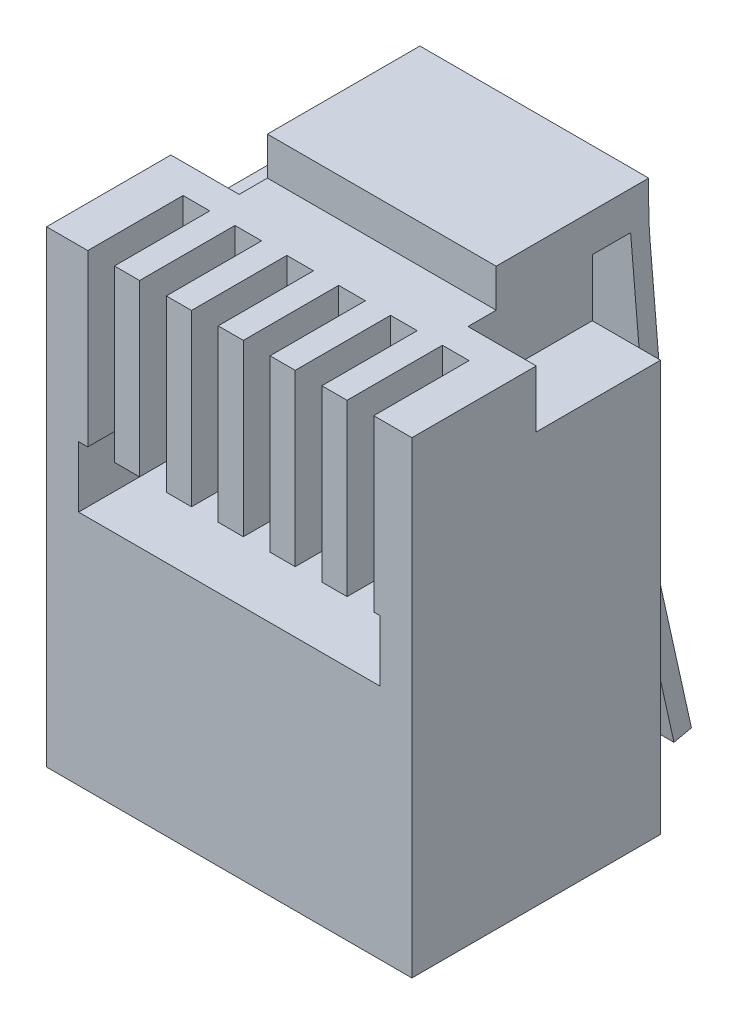
from build123d import *

# Parameters (mm, degrees)
SKETCH_1_W          = 9.58
SKETCH_1_H          = 12.27
EXTRUDE_1_DEPTH     = 6.52
SKETCH_2_W          = 7.9
SKETCH_2_H          = 1.6
CUT_EXTRUDE_1_DEPTH = 4
SKETCH_3_W          = 0.7
SKETCH_3_H          = 5.068026785
CUT_EXTRUDE_2_DEPTH = 2.5
SKETCH_4_W          = 6
SKETCH_4_H          = 4
EXTRUDE_2_DEPTH     = 1
SKETCH_5_W          = 1.79
SKETCH_5_H          = 3.771756959
CUT_EXTRUDE_3_DEPTH = 1.5
EXTRUDE_3_DEPTH     = 3
EXTRUDE_4_DEPTH     = 1.6
FILLET_1_R          = 10
SKETCH_8_W          = 7.58
SKETCH_8_H          = 4.52
CUT_EXTRUDE_4_DEPTH = 6


with BuildPart() as part:
    # 草图1 → 凸台-拉伸1 (new body)
    with BuildSketch(Plane.XY):
        with Locations((4.79, 6.135)):
            Rectangle(SKETCH_1_W, SKETCH_1_H)
    extrude(amount=EXTRUDE_1_DEPTH)

    # 草图2 → 切除-拉伸1 (cut)
    with BuildSketch(Plane.XY.offset(6.52)):
        with Locations((4.79, 7.01)):
            Rectangle(SKETCH_2_W, SKETCH_2_H)
    extrude(amount=-CUT_EXTRUDE_1_DEPTH, mode=Mode.SUBTRACT)

    # 草图3 → 切除-拉伸2 (cut)
    with BuildSketch(Plane.XY.offset(6.52)):
        with Locations((8.23, 10.008542357)):
            Rectangle(SKETCH_3_W, SKETCH_3_H)
        with Locations((6.87, 10.008542357)):
            Rectangle(SKETCH_3_W, SKETCH_3_H)
        with Locations((5.51, 10.008542357)):
            Rectangle(SKETCH_3_W, SKETCH_3_H)
        with Locations((4.15, 10.008542357)):
            Rectangle(SKETCH_3_W, SKETCH_3_H)
        with Locations((2.79, 10.008542357)):
            Rectangle(SKETCH_3_W, SKETCH_3_H)
        with Locations((1.43, 10.008542357)):
            Rectangle(SKETCH_3_W, SKETCH_3_H)
    extrude(amount=-CUT_EXTRUDE_2_DEPTH, mode=Mode.SUBTRACT)

    # 草图4 → 凸台-拉伸2 (add)
    with BuildSketch(Plane(origin=(0, 12.27, 0), x_dir=(1, 0, 0), z_dir=(0, 1, 0))):
        with Locations((4.79, -0.52)):
            Rectangle(SKETCH_4_W, SKETCH_4_H)
    extrude(amount=EXTRUDE_2_DEPTH)

    # 草图5 → 切除-拉伸3 (cut)
    with BuildSketch(Plane(origin=(0, 12.27, 0), x_dir=(1, 0, 0), z_dir=(0, 1, 0))):
        with Locations((8.685, -1.374121521)):
            Rectangle(SKETCH_5_W, SKETCH_5_H)
        with Locations((0.895, -1.374121521)):
            Rectangle(SKETCH_5_W, SKETCH_5_H)
    extrude(amount=-CUT_EXTRUDE_3_DEPTH, mode=Mode.SUBTRACT)

    # 草图6 → 凸台-拉伸3 (add, symmetric)
    with BuildSketch(Plane.ZY.offset(-4.79)):
        Polygon((-1.48, 12.27), (-1.75, 8.942581669), (-1.278125841, 8.904291917), (-1.005018858, 12.27), align=None)
    extrude(amount=EXTRUDE_3_DEPTH, both=True)

    # 草图7 → 凸台-拉伸4 (add, symmetric)
    with BuildSketch(Plane.ZY.offset(-4.79)):
        Polygon((-1.75, 8.942581669), (-4, -1.173649155), (-3.542253598, -1.275458754), (-1.278125841, 8.904291917), align=None)
    extrude(amount=EXTRUDE_4_DEPTH, both=True)

    # 圆角1
    # the kernel refuses this fillet: 10 mm, written as the material it adds along each edge
    with BuildSketch(Plane(origin=(1.79, 12.27, -1.48), x_dir=(0, -0.9967239953538545, -0.08087816198362402), z_dir=(1, 0, 0))) as fillet_1_piece_1:
        with BuildLine():
            CenterArc((FILLET_1_R * 0.0405054289786, FILLET_1_R), FILLET_1_R, 265.360955713, 4.639044287)
            Line((-FILLET_1_R * 0.040372733005, FILLET_1_R * 0.00327600464615), (0, 0))
            Line((0, 0), (FILLET_1_R * 0.0405054289786, 0))
        make_face()
    extrude(amount=6)

    # 草图8 → 切除-拉伸4 (cut)
    with BuildSketch(Plane.XZ):
        with Locations((4.79, 3.26)):
            Rectangle(SKETCH_8_W, SKETCH_8_H)
    extrude(amount=-CUT_EXTRUDE_4_DEPTH, mode=Mode.SUBTRACT)


solid = part.part
